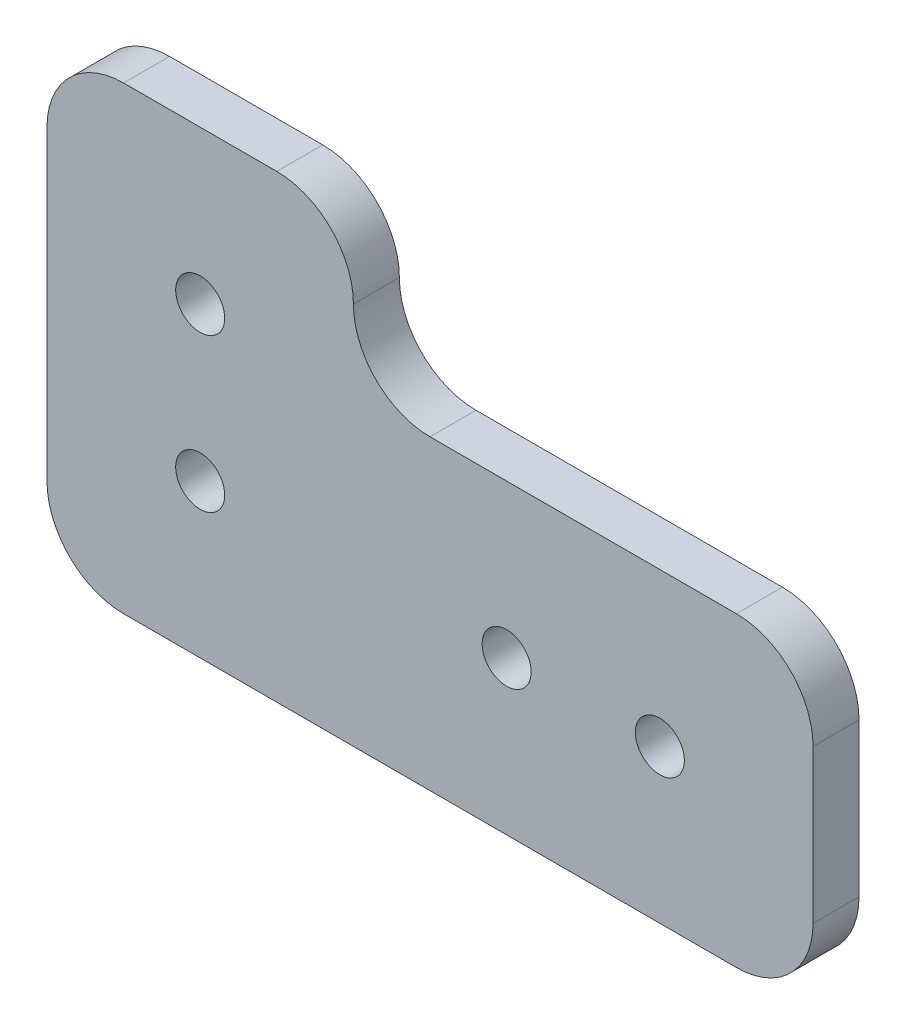
from build123d import *

# Parameters (mm, degrees)
SKETCH_1_R      = 1.6
EXTRUDE_1_DEPTH = 3
FILLET_1_R      = 5


with BuildPart() as part:
    # 草图1 → 凸台-拉伸1 (new body)
    with BuildSketch(Plane.XY):
        Polygon((0, 0), (0, 30), (20, 30), (20, 20), (50, 20), (50, 0), align=None)
        with Locations((10, 20)):
            Circle(SKETCH_1_R, mode=Mode.SUBTRACT)
        with Locations((10, 10)):
            Circle(SKETCH_1_R, mode=Mode.SUBTRACT)
        with Locations((30, 10)):
            Circle(SKETCH_1_R, mode=Mode.SUBTRACT)
        with Locations((40, 10)):
            Circle(SKETCH_1_R, mode=Mode.SUBTRACT)
    extrude(amount=EXTRUDE_1_DEPTH)

    # 圆角1
    fillet_1_edges = [part.edges().sort_by_distance(p)[0] for p in [
        (0, 0, 1.5),
        (50, 0, 1.5),
        (50, 20, 1.5),
        (20, 20, 1.5),
        (20, 30, 1.5),
        (0, 30, 1.5),
    ]]
    fillet(fillet_1_edges, radius=FILLET_1_R - 0.0001)  # a hair under: the kernel refuses the full size


solid = part.part
